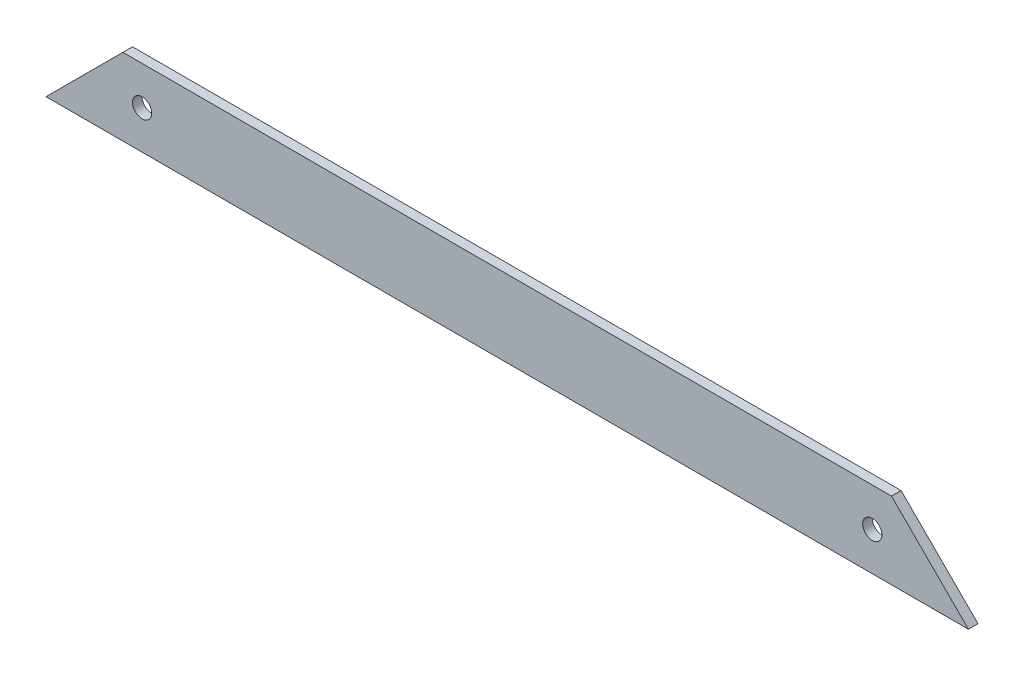
from build123d import *

# Parameters (mm, degrees)
SKETCH3_R           = 3.175
BOSS_EXTRUDE1_DEPTH = 3.175


with BuildPart() as part:
    # Sketch3 → Boss-Extrude1 (new body)
    with BuildSketch(Plane.XY):
        Polygon((127, 0), (-127, 0), (-152.4, -25.4), (152.4, -25.4), align=None)
        with Locations((-120.65, -12.7)):
            Circle(SKETCH3_R, mode=Mode.SUBTRACT)
        with Locations((120.65, -12.7)):
            Circle(SKETCH3_R, mode=Mode.SUBTRACT)
    extrude(amount=BOSS_EXTRUDE1_DEPTH)


solid = part.part
